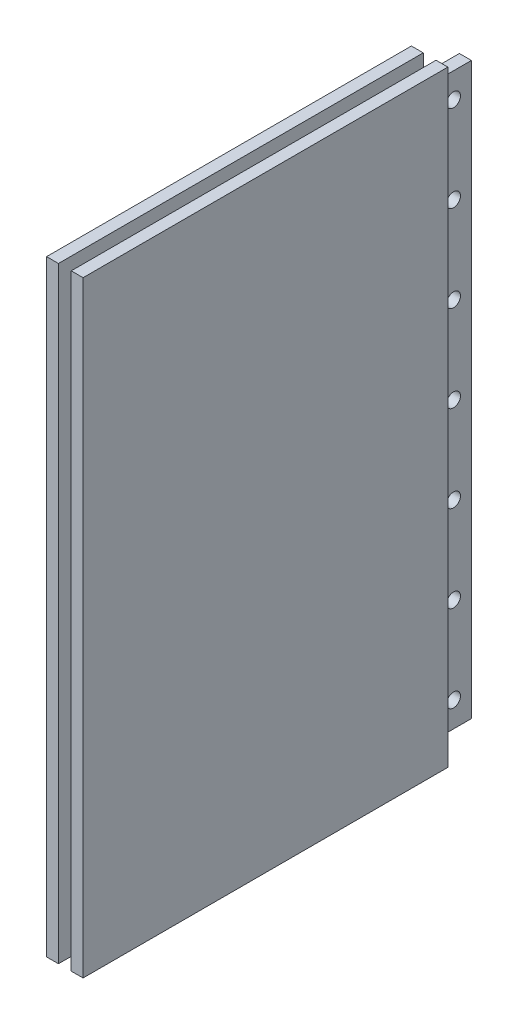
from build123d import *
from OCP.BRepFilletAPI import BRepFilletAPI_MakeChamfer

# Parameters (mm, degrees)
SKETCH1_W           = 166.25
SKETCH1_H           = 100
BOSS_EXTRUDE1_DEPTH = 10
SKETCH2_W           = 3.3
SKETCH2_H           = 9.8
BOSS_EXTRUDE2_DEPTH = 166.25
SKETCH3_W           = 3.5
SKETCH3_H           = 109.8
CUT_EXTRUDE1_DEPTH  = 5
CUT_EXTRUDE2_REACH  = 196.122
SKETCH4_R           = 1.9
LPATTERN1_COUNT     = 7
LPATTERN1_PITCH     = 23.75
SKETCH5_W           = 3.5
SKETCH5_H           = 156.25
CUT_EXTRUDE3_DEPTH  = 5
SKETCH6_W           = 146.25
SKETCH6_H           = 85
CUT_EXTRUDE4_DEPTH  = 5
CHAMFER1_SIZE       = 2.5
CHAMFER1_SIZE_2     = 5


with BuildPart() as part:
    # Sketch1 → Boss-Extrude1 (new body)
    with BuildSketch(Plane.YZ):
        with Locations((83.125, 50)):
            Rectangle(SKETCH1_W, SKETCH1_H)
    extrude(amount=-BOSS_EXTRUDE1_DEPTH)

    # Sketch2 → Boss-Extrude2 (add)
    with BuildSketch(Plane(origin=(0, 166.25, 0), x_dir=(-1, 0, 0), z_dir=(0, 1, 0))):
        with Locations((5, -4.9)):
            Rectangle(SKETCH2_W, SKETCH2_H)
    extrude(amount=-BOSS_EXTRUDE2_DEPTH)

    # Sketch3 → Cut-Extrude1 (cut)
    with BuildSketch(Plane(origin=(0, 166.25, 0), x_dir=(-1, 0, 0), z_dir=(0, 1, 0))):
        with Locations((5, 45.1)):
            Rectangle(SKETCH3_W, SKETCH3_H)
    cut_extrude1 = extrude(amount=-CUT_EXTRUDE1_DEPTH, mode=Mode.SUBTRACT)

    # Mirror1: Cut-Extrude1 across plane
    add(cut_extrude1.mirror(Plane.ZX.offset(83.125)), mode=Mode.SUBTRACT)

    # Sketch4 → Cut-Extrude2 (cut, up to next)
    with BuildSketch(Plane.YZ.offset(-3.35), mode=Mode.PRIVATE) as cut_extrude2_sk1:
        with Locations(Location((11.875, -4.9, 0), (0, 0, 270))):
            Circle(SKETCH4_R)
    cut_extrude2_tool1 = extrude(cut_extrude2_sk1.sketch, amount=-CUT_EXTRUDE2_REACH, mode=Mode.PRIVATE) & part.part
    cut_extrude2 = cut_extrude2_tool1.solids().sort_by_distance((-3.35, 11.875, -4.9))[0]
    add(cut_extrude2, mode=Mode.SUBTRACT)

    # LPattern1: Cut-Extrude2 ×7
    with Locations(*[(0, i * LPATTERN1_PITCH, 0) for i in range(1, LPATTERN1_COUNT)]):
        add(cut_extrude2, mode=Mode.SUBTRACT)

    # Sketch5 → Cut-Extrude3 (cut)
    with BuildSketch(Plane.XY.offset(100)):
        with Locations((-5, 83.125)):
            Rectangle(SKETCH5_W, SKETCH5_H)
    extrude(amount=-CUT_EXTRUDE3_DEPTH, mode=Mode.SUBTRACT)

    # Sketch6 → Cut-Extrude4 (cut)
    with BuildSketch(Plane.YZ.offset(-10)):
        with Locations((83.125, 47.5)):
            Rectangle(SKETCH6_W, SKETCH6_H)
    extrude(amount=CUT_EXTRUDE4_DEPTH, mode=Mode.SUBTRACT)

    # Chamfer1
    chamfer1_edges_1 = [part.edges().sort_by_distance(p)[0] for p in [
        (-10, 10, 47.5),
    ]]
    chamfer1_side_1 = [part.faces().sort_by_distance(p)[0] for p in [
        (-10, 9.95, 47.5),
    ]]
    chamfer1_edges_2 = [part.edges().sort_by_distance(p)[0] for p in [
        (-10, 83.125, 5),
    ]]
    chamfer1_side_2 = [part.faces().sort_by_distance(p)[0] for p in [
        (-10, 83.125, 4.95),
    ]]
    chamfer1_edges_3 = [part.edges().sort_by_distance(p)[0] for p in [
        (-10, 156.25, 47.5),
    ]]
    chamfer1_side_3 = [part.faces().sort_by_distance(p)[0] for p in [
        (-10, 156.3, 47.5),
    ]]
    chamfer1_edges_4 = [part.edges().sort_by_distance(p)[0] for p in [
        (-10, 83.125, 90),
    ]]
    chamfer1_side_4 = [part.faces().sort_by_distance(p)[0] for p in [
        (-10, 83.125, 90.05),
    ]]
    chamfer1 = BRepFilletAPI_MakeChamfer(part.part.solid().wrapped)
    for e in chamfer1_edges_1:
        chamfer1.Add(CHAMFER1_SIZE - 0.0001, CHAMFER1_SIZE_2 - 0.0001, e.wrapped, chamfer1_side_1[0].wrapped)
    for e in chamfer1_edges_2:
        chamfer1.Add(CHAMFER1_SIZE - 0.0001, CHAMFER1_SIZE_2 - 0.0001, e.wrapped, chamfer1_side_2[0].wrapped)
    for e in chamfer1_edges_3:
        chamfer1.Add(CHAMFER1_SIZE - 0.0001, CHAMFER1_SIZE_2 - 0.0001, e.wrapped, chamfer1_side_3[0].wrapped)
    for e in chamfer1_edges_4:
        chamfer1.Add(CHAMFER1_SIZE - 0.0001, CHAMFER1_SIZE_2 - 0.0001, e.wrapped, chamfer1_side_4[0].wrapped)
    add(Compound.cast(chamfer1.Shape()), mode=Mode.REPLACE)  # a hair under: the kernel refuses the full size


solid = part.part
